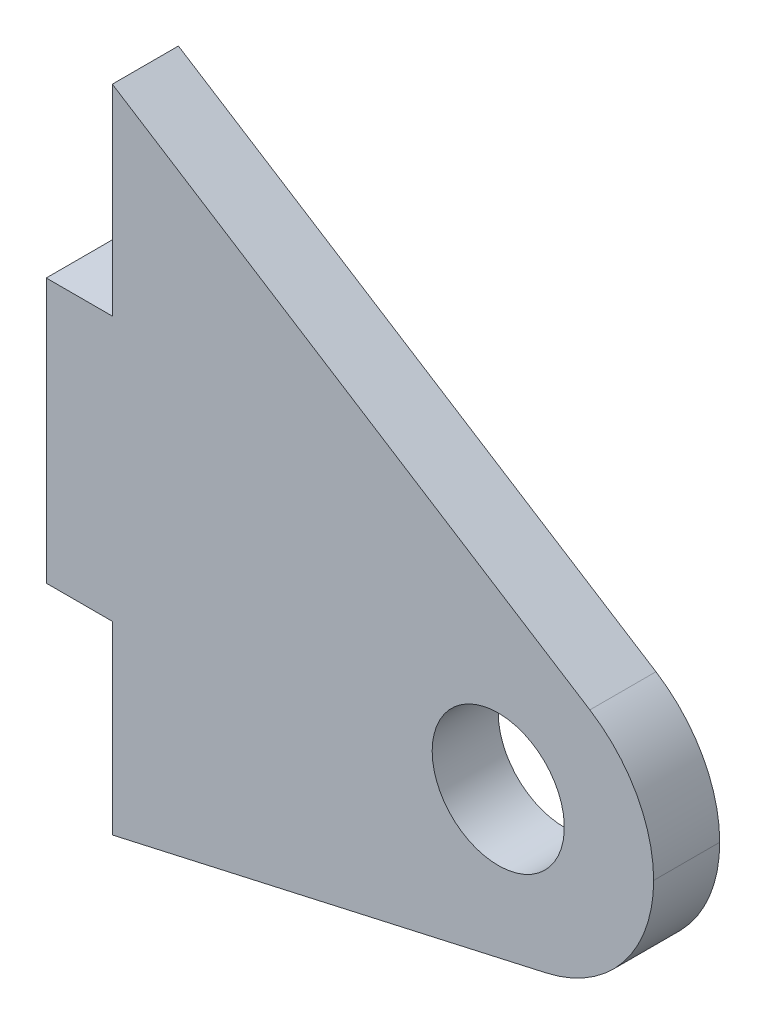
from build123d import *

# Parameters (mm, degrees)
SKETCH1_W                   = 68.548183611
SKETCH1_H                   = 64.912098736
BOSS_EXTRUDE1_DEPTH         = 3.175
F_1_4_0_25_DIAMETER_HOLE1_D = 6.35
CUT_EXTRUDE1_DEPTH          = 95.459063428
FILLET1_R                   = 6.604
SKETCH5_W                   = 3.175
SKETCH5_H                   = 12.7
BOSS_EXTRUDE2_DEPTH         = 3.175


with BuildPart() as part:
    # Sketch1 → Boss-Extrude1 (new body)
    with BuildSketch(Plane.XY):
        with Locations((34.274091805, 32.456049368)):
            Rectangle(SKETCH1_W, SKETCH1_H)
    extrude(amount=BOSS_EXTRUDE1_DEPTH)

    # 1/4 (0.25) Diameter Hole1 (through all)
    with Locations(Plane(origin=(0, 0, 0), x_dir=(-1, 0, 0), z_dir=(0, 0, -1))):
        with Locations((-18.542, 44.846098736)):
            Hole(F_1_4_0_25_DIAMETER_HOLE1_D / 2)

    # Sketch4 → Cut-Extrude1 (cut, through all)
    with BuildSketch(Plane(origin=(0, 0, 0), x_dir=(-1, 0, 0), z_dir=(0, 0, -1))):
        Polygon((-26.0096, 48.402098736), (0, 64.912098736), (-68.548183611, 64.912098736), (-68.548183611, 0), (0, 0), (0, 33.670098736), (-26.0096, 39.512098736), align=None)
    extrude(amount=-CUT_EXTRUDE1_DEPTH, mode=Mode.SUBTRACT)

    # Fillet1
    # the kernel refuses this fillet: 6.604 mm, written as the material it takes off along each edge
    with BuildSketch(Plane(origin=(26.0096, 48.402098736, -9.075328034), x_dir=(-0.84427202966114, 0.5359148625778718, 0), z_dir=(0, 0, 1))) as fillet1_piece_1:
        with BuildLine():
            CenterArc((FILLET1_R * 0.549686737352, FILLET1_R), FILLET1_R, 212.405976432, 57.594023568)
            Line((-FILLET1_R * 0.294585292309, FILLET1_R * 0.464085137422), (0, 0))
            Line((0, 0), (FILLET1_R * 0.549686737352, 0))
        make_face()
    extrude(amount=21.325656067, mode=Mode.SUBTRACT)
    with BuildSketch(Plane(origin=(26.0096, 39.512098736, -13.213034706), x_dir=(-0.9756913106586464, -0.21914941547997013, 0), z_dir=(0, 0, 1))) as fillet1_piece_2:
        with BuildLine():
            CenterArc((FILLET1_R * 0.800304948901, -FILLET1_R), FILLET1_R, 90, 77.340921003)
            Line((-FILLET1_R * 0.175386361757, -FILLET1_R * 0.78085058452), (0, 0))
            Line((0, 0), (FILLET1_R * 0.800304948901, 0))
        make_face()
    extrude(amount=29.601069413, mode=Mode.SUBTRACT)

    # Sketch5 → Boss-Extrude2 (add)
    with BuildSketch(Plane(origin=(0, 0, 0), x_dir=(-1, 0, 0), z_dir=(0, 0, -1))):
        with Locations((1.5875, 48.910098736)):
            Rectangle(SKETCH5_W, SKETCH5_H)
    extrude(amount=-BOSS_EXTRUDE2_DEPTH)


solid = part.part
